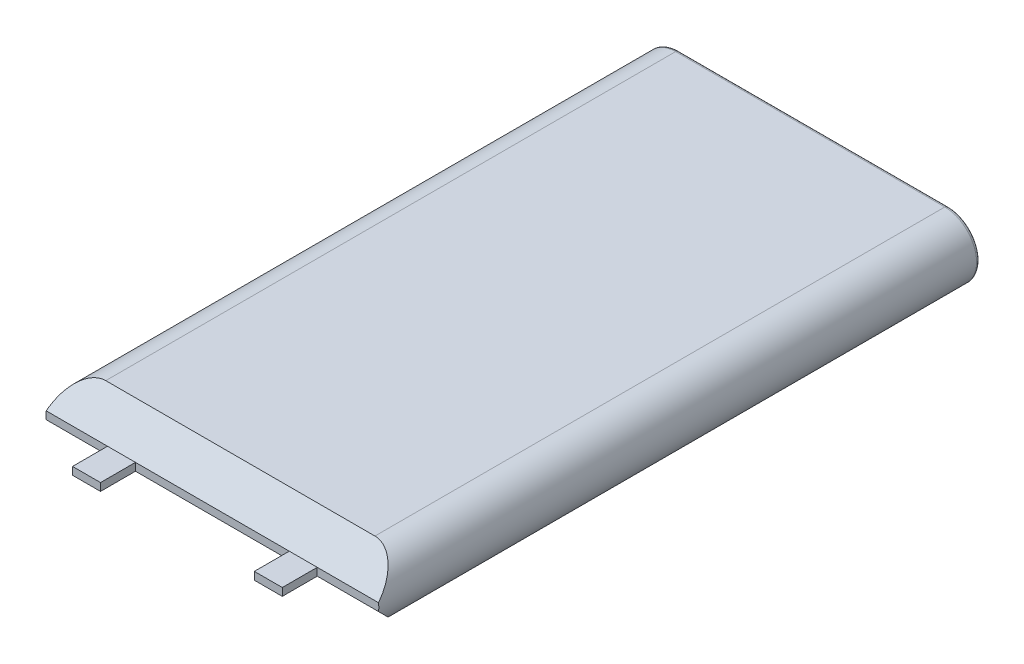
from build123d import *

# Parameters (mm, degrees)
BOSS_EXTRUDE1_DEPTH = 109.22
FILLET1_R           = 0.635
CHAMFER1_SIZE       = 5.08
SKETCH2_W           = 5.08
SKETCH2_H           = 1.397
BOSS_EXTRUDE2_DEPTH = 6.35


with BuildPart() as part:
    # Sketch1 → Boss-Extrude1 (new body)
    with BuildSketch(Plane.XY):
        with BuildLine():
            Line((24.4475, -5.7785), (-24.4475, -5.7785))
            ThreePointArc((-24.4475, -5.7785), (-30.226, 0), (-24.4475, 5.7785))
            Line((-24.4475, 5.7785), (24.4475, 5.7785))
            ThreePointArc((24.4475, 5.7785), (30.226, 0), (24.4475, -5.7785))
        make_face()
    extrude(amount=BOSS_EXTRUDE1_DEPTH)

    # Fillet1
    fillet1_edges = [part.edges().sort_by_distance(p)[0] for p in [
        (0, 5.7785, 0),
        (30.226, 0, 0),
        (0, -5.7785, 0),
        (-30.226, 0, 0),
    ]]
    fillet(fillet1_edges, radius=FILLET1_R)

    # Chamfer1
    # the kernel refuses this chamfer: 5.08 mm, written as the material it takes off along each edge
    with BuildSketch(Plane(origin=(-37.511649579, 5.7785, 109.22), x_dir=(0, 0.02749587661058642, -0.9996219169112968), z_dir=(1, 0, 0))) as chamfer1_piece_1:
        Polygon((CHAMFER1_SIZE * 0.999621916911, -CHAMFER1_SIZE * 0.0274958766106), (-CHAMFER1_SIZE * 0.0274958766106, -CHAMFER1_SIZE * 0.999621916911), (0, 0), align=None)
    extrude(amount=75.023299158, mode=Mode.SUBTRACT)
    with BuildSketch(Plane(origin=(37.511649579, -5.7785, 109.22), x_dir=(0, 0.9996219169112966, 0.02749587661058728), z_dir=(-1, 0, 0))) as chamfer1_piece_2:
        Polygon((CHAMFER1_SIZE * 0.999621916911, CHAMFER1_SIZE * 0.0274958766106), (-CHAMFER1_SIZE * 0.0274958766106, CHAMFER1_SIZE * 0.999621916911), (0, 0), align=None)
    extrude(amount=75.023299158, mode=Mode.SUBTRACT)

    # Sketch2 → Boss-Extrude2 (add)
    with BuildSketch(Plane.XY.offset(109.22)):
        with Locations((-16.51, 0)):
            Rectangle(SKETCH2_W, SKETCH2_H)
        with Locations((16.51, 0)):
            Rectangle(SKETCH2_W, SKETCH2_H)
    extrude(amount=BOSS_EXTRUDE2_DEPTH)


solid = part.part
